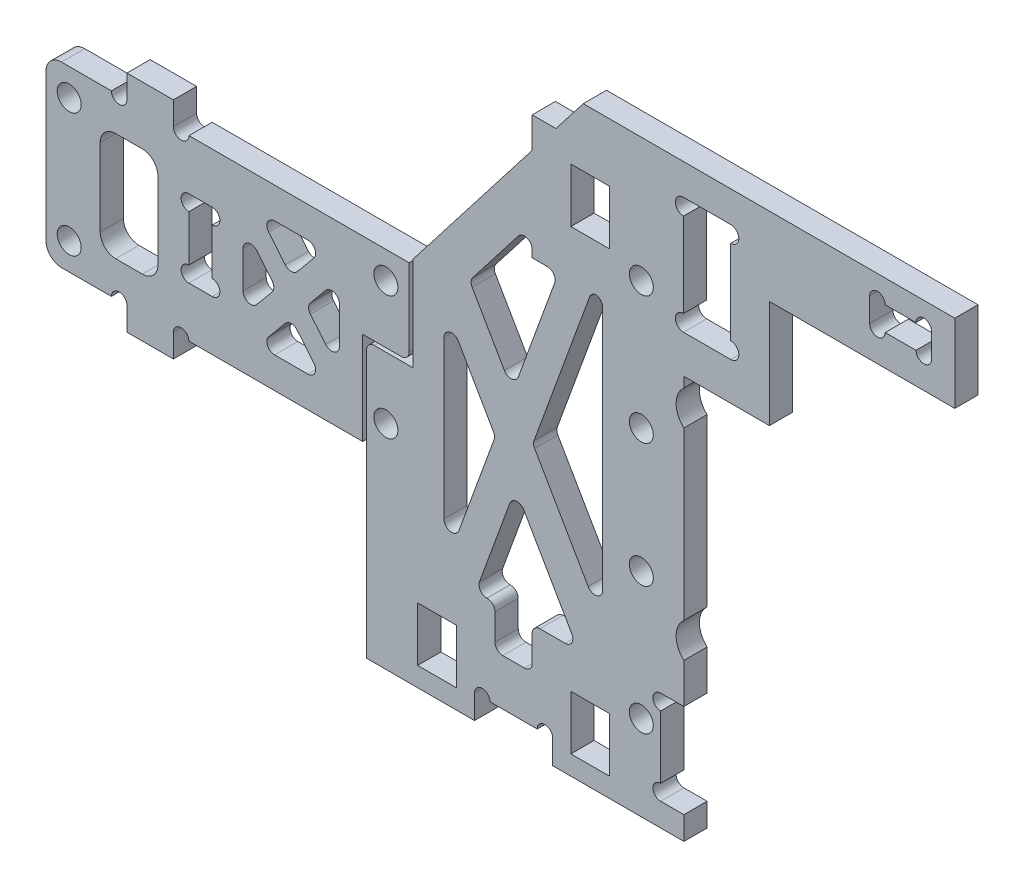
from build123d import *

# Parameters (mm, degrees)
SKETCH_1_R          = 1.55
EXTRUDE_1_DEPTH     = 3
SKETCH_1_W          = 7.455
SKETCH_1_H          = 14
EXTRUDE_1_2_DEPTH   = 3
FILLET_1_R          = 2
FILLET_2_R          = 1
SKETCH_5_W          = 3
SKETCH_5_H          = 3
EXTRUDE_2_DEPTH     = 3
SKETCH_4_R          = 1
SKETCH_4_W          = 5
SKETCH_4_H          = 7
CUT_EXTRUDE_2_DEPTH = 103.375995844
FILLET_3_R          = 1
FILLET_4_R          = 1
SKETCH_6_W          = 11
SKETCH_6_H          = 16
SKETCH_6_W_2        = 5
SKETCH_6_H_2        = 7
EXTRUDE_3_DEPTH     = 3
FILLET_5_R          = 1
SKETCH_7_R          = 3
CUT_EXTRUDE_3_DEPTH = 10


with BuildPart() as part:
    # 草图1 → 凸台-拉伸1 (new body)
    with BuildSketch(Plane.XY):
        Polygon((23.955, 0), (17.955, 0), (17.955, -35.5), (31.906563512, -35.5), (31.906563512, -32.4), (42.006563512, -32.4), (42.006563512, -35.5), (55.955, -35.5), (55.955, 16.55), (70.005, 16.55), (70.005, 30.45), (93.955, 30.45), (93.955, 40.55), (45.955, 40.55), (23.955, 12.145555556), align=None)
        Polygon((34.595244503, -2.368824804), (27.955, -20.565703721), (27.955, 9.144573034), align=None, mode=Mode.SUBTRACT)
        Polygon((37.203174016, -6.890665831), (48.455, -26.4), (30.083999922, -26.4), align=None, mode=Mode.SUBTRACT)
        with Locations((53.455, -24.5)):
            Circle(SKETCH_1_R, mode=Mode.SUBTRACT)
        with Locations((53.455, -8)):
            Circle(SKETCH_1_R, mode=Mode.SUBTRACT)
        Polygon((48.455, 23.943758254), (48.455, -16.39207134), (39.439945279, -0.761033733), align=None, mode=Mode.SUBTRACT)
        with Locations((53.455, 8)):
            Circle(SKETCH_1_R, mode=Mode.SUBTRACT)
        Polygon((36.832015766, 3.760807293), (31.263414128, 13.416103275), (48.455, 35.612350812), align=None, mode=Mode.SUBTRACT)
        with Locations((53.455, 24.5)):
            Circle(SKETCH_1_R, mode=Mode.SUBTRACT)
        with BuildLine():
            Line((58.905, 36.55), (65.005, 36.55))
            ThreePointArc((65.005, 36.55), (66.055, 35.5), (65.005, 34.45))
            Line((65.005, 34.45), (65.005, 23.55))
            ThreePointArc((65.005, 23.55), (66.055, 22.5), (65.005, 21.45))
            Line((65.005, 21.45), (58.905, 21.45))
            ThreePointArc((58.905, 21.45), (57.855, 22.5), (58.905, 23.55))
            Line((58.905, 23.55), (58.905, 34.45))
            ThreePointArc((58.905, 34.45), (57.855, 35.5), (58.905, 36.55))
        make_face(mode=Mode.SUBTRACT)
        with BuildLine():
            ThreePointArc((82.955, 37.55), (83.96, 38.555), (84.965, 37.55))
            Line((84.965, 37.55), (88.945, 37.55))
            ThreePointArc((88.945, 37.55), (89.95, 38.555), (90.955, 37.55))
            Line((90.955, 37.55), (90.955, 34.45))
            ThreePointArc((90.955, 34.45), (89.95, 33.445), (88.945, 34.45))
            Line((88.945, 34.45), (84.965, 34.45))
            ThreePointArc((84.965, 34.45), (83.96, 33.445), (82.955, 34.45))
            Line((82.955, 34.45), (82.955, 37.55))
        make_face(mode=Mode.SUBTRACT)
        with Locations((20.455, -8)):
            Circle(SKETCH_1_R, mode=Mode.SUBTRACT)
    extrude(amount=EXTRUDE_1_DEPTH)

    # 草图5 → 凸台-拉伸2 (add)
    with BuildSketch(Plane.XY.offset(3)):
        with Locations((57.455, -34)):
            Rectangle(SKETCH_5_W, SKETCH_5_H)
        Polygon((55.955, -20.4), (58.955, -20.4), (58.955, -5.5), (58.955, 5.6), (58.955, 16.55), (55.955, 16.55), (55.955, 5.6), (55.955, -5.5), align=None)
    extrude(amount=-EXTRUDE_2_DEPTH)

    # 草图4 → 切除-拉伸2 (cut, through all)
    with BuildSketch(Plane.XY.offset(3)):
        with Locations((55.955, -21.4)):
            Circle(SKETCH_4_R)
        with Locations((55.955, -31.5)):
            Circle(SKETCH_4_R)
        with Locations((41.006563512, -32.4)):
            Circle(SKETCH_4_R)
        with Locations((32.906563512, -32.4)):
            Circle(SKETCH_4_R)
        with Locations((46.855, -29.5)):
            Rectangle(SKETCH_4_W, SKETCH_4_H)
        with Locations((27.055, -29.5)):
            Rectangle(SKETCH_4_W, SKETCH_4_H)
        with Locations((46.855, 29.5)):
            Rectangle(SKETCH_4_W, SKETCH_4_H)
        with Locations((27.055, 29.5)):
            Rectangle(SKETCH_4_W, SKETCH_4_H)
    extrude(amount=-CUT_EXTRUDE_2_DEPTH, mode=Mode.SUBTRACT)

    # 圆角3
    fillet_3_edges = [part.edges().sort_by_distance(p)[0] for p in [
        (17.955, 0, 1.5),
    ]]
    fillet(fillet_3_edges, radius=FILLET_3_R)

    # 草图6 → 凸台-拉伸3 (add)
    # profile 1 of 3: a face of its own
    with BuildSketch(Plane.XY.offset(3)):
        Polygon((29.555, -30.4), (29.555, -26), (24.555, -26), (24.555, -21), (34.555, -21), (34.555, -30.4), align=None)
    # profile 2 of 3: a face of its own
    with BuildSketch(Plane.XY.offset(3)):
        Polygon((44.355, -26.4), (44.355, -26), (49.355, -26), (49.355, -21), (39.355, -21), (39.355, -30.4), (44.355, -30.4), align=None)
    # profile 3 of 3: a face of its own
    with BuildSketch(Plane.XY.offset(3)):
        with Locations((44.855, 28)):
            Rectangle(SKETCH_6_W, SKETCH_6_H)
        with Locations((46.855, 29.5)):
            Rectangle(SKETCH_6_W_2, SKETCH_6_H_2, mode=Mode.SUBTRACT)
    extrude(amount=-EXTRUDE_3_DEPTH)

    # 圆角5
    # the kernel refuses this fillet: 1 mm, written as the material it adds along each edge
    with BuildSketch(Plane(origin=(32.054520278, -21, 0), x_dir=(0.3428005545606434, 0.9394082072203305, 0), z_dir=(0, 0, 1))) as fillet_5_piece_1:
        with BuildLine():
            CenterArc((FILLET_5_R * 1.42941113803, -FILLET_5_R), FILLET_5_R, 90, 110.047591132)
            Line((FILLET_5_R * 0.490002930813, -FILLET_5_R * 1.34280055456), (0, 0))
            Line((0, 0), (FILLET_5_R * 1.42941113803, 0))
        make_face()
    extrude(amount=3)
    with BuildSketch(Plane(origin=(34.555, -26.4, 3), x_dir=(0, 1, 0), z_dir=(0, 0, -1)), Plane(origin=(48.455, 20, 3), x_dir=(0, -1, 0), z_dir=(0, 0, -1))) as fillet_5_piece_2:
        with BuildLine():
            CenterArc((FILLET_5_R, FILLET_5_R), FILLET_5_R, 180, 90)
            Line((0, FILLET_5_R), (0, 0))
            Line((0, 0), (FILLET_5_R, 0))
        make_face()
    extrude(amount=3)
    with BuildSketch(Plane(origin=(39.355, -26.4, 3), x_dir=(0, 1, 0), z_dir=(0, 0, -1))) as fillet_5_piece_3:
        with BuildLine():
            CenterArc((FILLET_5_R, -FILLET_5_R), FILLET_5_R, 90, 90)
            Line((0, -FILLET_5_R), (0, 0))
            Line((0, 0), (FILLET_5_R, 0))
        make_face()
    extrude(amount=3)
    with BuildSketch(Plane(origin=(45.340600514, -21, 0), x_dir=(-1, 0, 0), z_dir=(0, 0, 1))) as fillet_5_piece_4:
        with BuildLine():
            CenterArc((FILLET_5_R * 1.73113649293, -FILLET_5_R), FILLET_5_R, 90, 119.973796441)
            Line((FILLET_5_R * 0.864882510539, -FILLET_5_R * 1.49960388107), (0, 0))
            Line((0, 0), (FILLET_5_R * 1.73113649293, 0))
        make_face()
    extrude(amount=3)
    with BuildSketch(Plane(origin=(39.355, 23.863239701, 0), x_dir=(0, -1, 0), z_dir=(0, 0, 1))) as fillet_5_piece_5:
        with BuildLine():
            CenterArc((FILLET_5_R * 2.92419650423, -FILLET_5_R), FILLET_5_R, 90, 142.24126255)
            Line((FILLET_5_R * 2.31185865331, -FILLET_5_R * 1.79059620308), (0, 0))
            Line((0, 0), (FILLET_5_R * 2.92419650423, 0))
        make_face()
    extrude(amount=3)
    with BuildSketch(Plane(origin=(42.75787869, 20, 3), x_dir=(-0.3428005545606398, -0.9394082072203318, 0), z_dir=(0, 0, -1))) as fillet_5_piece_6:
        with BuildLine():
            CenterArc((FILLET_5_R * 1.42941113803, FILLET_5_R), FILLET_5_R, 159.952408868, 110.047591132)
            Line((FILLET_5_R * 0.490002930813, FILLET_5_R * 1.34280055456), (0, 0))
            Line((0, 0), (FILLET_5_R * 1.42941113803, 0))
        make_face()
    extrude(amount=3)
    with BuildSketch(Plane(origin=(47.015878534, 20, 0), x_dir=(1, 0, 0), z_dir=(0, 0, 1))) as fillet_5_piece_7:
        with BuildLine():
            CenterArc((FILLET_5_R * 0.699588784075, -FILLET_5_R), FILLET_5_R, 90, 69.952408868)
            Line((-FILLET_5_R * 0.239819423145, -FILLET_5_R * 0.657199445439), (0, 0))
            Line((0, 0), (FILLET_5_R * 0.699588784075, 0))
        make_face()
    extrude(amount=3)
    with BuildSketch(Plane(origin=(37.203174016, -6.890665831, 0), x_dir=(0.4996038810742074, -0.8662539823952263, 0), z_dir=(0, 0, 1)), Plane(origin=(36.832015766, 3.760807293, 0), x_dir=(-0.4996038810742076, 0.8662539823952263, 0), z_dir=(0, 0, 1))) as fillet_5_piece_8:
        with BuildLine():
            CenterArc((FILLET_5_R * 2.14346234805, -FILLET_5_R), FILLET_5_R, 90, 129.978612427)
            Line((FILLET_5_R * 1.37717801626, -FILLET_5_R * 1.64250161311), (0, 0))
            Line((0, 0), (FILLET_5_R * 2.14346234805, 0))
        make_face()
    extrude(amount=3)
    with BuildSketch(Plane(origin=(27.955, 9.144573034, 0), x_dir=(0, -1, 0), z_dir=(0, 0, 1))) as fillet_5_piece_9:
        with BuildLine():
            CenterArc((FILLET_5_R * 3.73546734341, FILLET_5_R), FILLET_5_R, 119.973796441, 150.026203559)
            Line((FILLET_5_R * 3.23586346234, FILLET_5_R * 1.8662539824), (0, 0))
            Line((0, 0), (FILLET_5_R * 3.73546734341, 0))
        make_face()
    extrude(amount=3)
    with BuildSketch(Plane(origin=(27.955, -20.565703721, 0), x_dir=(0, 1, 0), z_dir=(0, 0, 1))) as fillet_5_piece_10:
        with BuildLine():
            CenterArc((FILLET_5_R * 5.65754104367, -FILLET_5_R), FILLET_5_R, 90, 159.952408868)
            Line((FILLET_5_R * 5.31474048911, -FILLET_5_R * 1.93940820722), (0, 0))
            Line((0, 0), (FILLET_5_R * 5.65754104367, 0))
        make_face()
    extrude(amount=3)
    with BuildSketch(Plane(origin=(34.595244503, -2.368824804, 0), x_dir=(-0.3428005545606447, -0.93940820722033, 0), z_dir=(0, 0, 1))) as fillet_5_piece_11:
        with BuildLine():
            CenterArc((FILLET_5_R * 0.466534903638, -FILLET_5_R), FILLET_5_R, 90, 50.021387573)
            Line((-FILLET_5_R * 0.299749428158, -FILLET_5_R * 0.357498386894), (0, 0))
            Line((0, 0), (FILLET_5_R * 0.466534903638, 0))
        make_face()
    extrude(amount=3)
    with BuildSketch(Plane(origin=(39.439945279, -0.761033733, 0), x_dir=(0.499603881074205, -0.8662539823952278, 0), z_dir=(0, 0, 1))) as fillet_5_piece_12:
        with BuildLine():
            CenterArc((FILLET_5_R * 0.466534903638, FILLET_5_R), FILLET_5_R, 219.978612427, 50.021387573)
            Line((-FILLET_5_R * 0.299749428158, FILLET_5_R * 0.357498386894), (0, 0))
            Line((0, 0), (FILLET_5_R * 0.466534903638, 0))
        make_face()
    extrude(amount=3)
    with BuildSketch(Plane(origin=(48.455, -16.39207134, 0), x_dir=(-0.4996038810742064, 0.8662539823952269, 0), z_dir=(0, 0, 1))) as fillet_5_piece_13:
        with BuildLine():
            CenterArc((FILLET_5_R * 3.73546734341, -FILLET_5_R), FILLET_5_R, 90, 150.026203559)
            Line((FILLET_5_R * 3.23586346234, -FILLET_5_R * 1.8662539824), (0, 0))
            Line((0, 0), (FILLET_5_R * 3.73546734341, 0))
        make_face()
    extrude(amount=3)
    with BuildSketch(Plane(origin=(31.263414128, 13.416103275, 0), x_dir=(0.4996038810742084, -0.8662539823952259, 0), z_dir=(0, 0, 1))) as fillet_5_piece_14:
        with BuildLine():
            CenterArc((FILLET_5_R * 0.671117848641, FILLET_5_R), FILLET_5_R, 202.267466108, 67.732533892)
            Line((-FILLET_5_R * 0.254307184715, FILLET_5_R * 0.621069257464), (0, 0))
            Line((0, 0), (FILLET_5_R * 0.671117848641, 0))
        make_face()
    extrude(amount=3)
    # the kernel refuses this fillet: 1 mm, written as the material it takes off along each edge
    with BuildSketch(Plane(origin=(34.555, -21, 5.5), x_dir=(0, -1, 0), z_dir=(0, 0, -1)), Plane(origin=(39.355, -21, 5.5), x_dir=(1, 0, 0), z_dir=(0, 0, -1))) as fillet_5_2_piece_1:
        with BuildLine():
            CenterArc((FILLET_5_R, FILLET_5_R), FILLET_5_R, 180, 90)
            Line((0, FILLET_5_R), (0, 0))
            Line((0, 0), (FILLET_5_R, 0))
        make_face()
    extrude(amount=8, mode=Mode.SUBTRACT)

    # 草图7 → 切除-拉伸3 (cut)
    with BuildSketch(Plane.XY.offset(3)):
        with Locations((60.955, -13)):
            Circle(SKETCH_7_R)
        with Locations((60.955, 13)):
            Circle(SKETCH_7_R)
    extrude(amount=-CUT_EXTRUDE_3_DEPTH, mode=Mode.SUBTRACT)


with BuildPart() as body_2:
    # 草图1 → Extrude 1 2 (new body)
    with BuildSketch(Plane.XY):
        with BuildLine():
            Line((-13, 14.5), (-13, 11.5))
            ThreePointArc((-13, 11.5), (-14.005, 10.495), (-15.01, 11.5))
            Line((-15.01, 11.5), (-23.455, 11.5))
            Line((-23.455, 11.5), (-23.455, -11.5))
            Line((-23.455, -11.5), (-15.01, -11.5))
            ThreePointArc((-15.01, -11.5), (-14.005, -10.495), (-13, -11.5))
            Line((-13, -11.5), (-13, -14.5))
            Line((-13, -14.5), (-7, -14.5))
            Line((-7, -14.5), (-7, -11.5))
            ThreePointArc((-7, -11.5), (-5.995, -10.495), (-4.99, -11.5))
            Line((-4.99, -11.5), (17.455, -11.5))
            Line((17.455, -11.5), (17.455, 0.5))
            Line((17.455, 0.5), (23.455, 0.5))
            Line((23.455, 0.5), (23.455, 11.5))
            Line((23.455, 11.5), (-4.99, 11.5))
            ThreePointArc((-4.99, 11.5), (-5.995, 10.495), (-7, 11.5))
            Line((-7, 11.5), (-7, 14.5))
            Line((-7, 14.5), (-13, 14.5))
        make_face()
        with Locations((-20.455, -8)):
            Circle(SKETCH_1_R, mode=Mode.SUBTRACT)
        with Locations((-12.7275, 0)):
            Rectangle(SKETCH_1_W, SKETCH_1_H, mode=Mode.SUBTRACT)
        with BuildLine():
            ThreePointArc((-2, -2.99), (-0.995, -3.995), (-2, -5))
            Line((-2, -5), (-5, -5))
            ThreePointArc((-5, -5), (-6.005, -3.995), (-5, -2.99))
            Line((-5, -2.99), (-5, 2.99))
            ThreePointArc((-5, 2.99), (-6.005, 3.995), (-5, 5))
            Line((-5, 5), (-2, 5))
            ThreePointArc((-2, 5), (-0.995, 3.995), (-2, 2.99))
            Line((-2, 2.99), (-2, -2.99))
        make_face(mode=Mode.SUBTRACT)
        Polygon((2, -5.151925346), (2, 5.151925346), (6.277815346, 0), align=None, mode=Mode.SUBTRACT)
        Polygon((8.2275, -2.348074654), (12.505315346, -7.5), (3.949684654, -7.5), align=None, mode=Mode.SUBTRACT)
        Polygon((10.177184654, 0), (14.455, 5.151925346), (14.455, -5.151925346), align=None, mode=Mode.SUBTRACT)
        with Locations((-20.455, 8)):
            Circle(SKETCH_1_R, mode=Mode.SUBTRACT)
        Polygon((3.949684654, 7.5), (12.505315346, 7.5), (8.2275, 2.348074654), align=None, mode=Mode.SUBTRACT)
        with Locations((20.455, 8)):
            Circle(SKETCH_1_R, mode=Mode.SUBTRACT)
    extrude(amount=EXTRUDE_1_2_DEPTH)

    # 圆角1
    fillet_1_edges = [body_2.edges().sort_by_distance(p)[0] for p in [
        (-23.455, -11.5, 1.5),
        (-23.455, 11.5, 1.5),
        (-16.455, -7, 1.5),
        (-9, -7, 1.5),
        (-9, 7, 1.5),
        (-16.455, 7, 1.5),
    ]]
    fillet(fillet_1_edges, radius=FILLET_1_R)

    # 圆角2
    fillet_2_edges = [body_2.edges().sort_by_distance(p)[0] for p in [
        (12.505315346, 7.5, 1.5),
        (3.949684654, 7.5, 1.5),
        (8.2275, 2.348074654, 1.5),
        (2, 5.151925346, 1.5),
        (2, -5.151925346, 1.5),
        (6.277815346, 0, 1.5),
        (12.505315346, -7.5, 1.5),
        (8.2275, -2.348074654, 1.5),
        (3.949684654, -7.5, 1.5),
        (14.455, -5.151925346, 1.5),
        (14.455, 5.151925346, 1.5),
        (10.177184654, 0, 1.5),
    ]]
    fillet(fillet_2_edges, radius=FILLET_2_R)

    # 圆角4
    fillet_4_edges = [body_2.edges().sort_by_distance(p)[0] for p in [
        (23.455, 0.5, 1.5),
    ]]
    fillet(fillet_4_edges, radius=FILLET_4_R)


solid = Compound([part.part, body_2.part])
